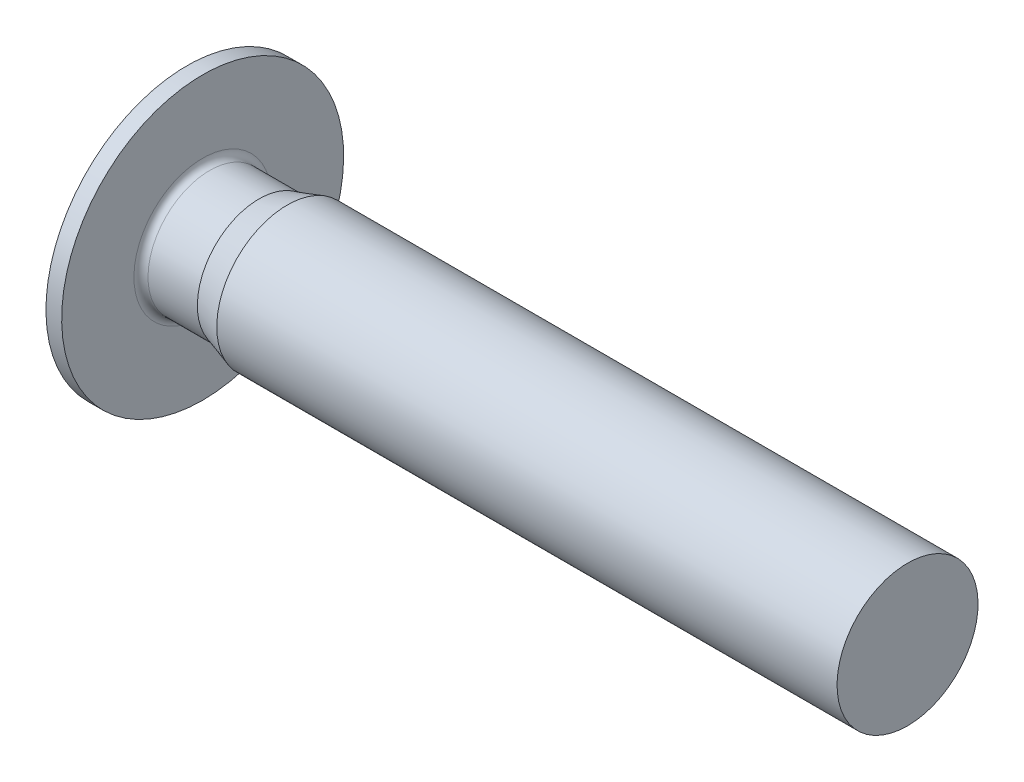
from build123d import *

# Parameters (mm, degrees)
FILLET1_R          = 0.1
CUT_EXTRUDE1_DEPTH = 1.2


with BuildPart() as part:
    # Sketch1 → Revolve1 (revolve)
    with BuildSketch(Plane.XY):
        Polygon((-0.5, 0), (-0.5, 1.52), (-0.222871871, 2), (0, 2), (0, 0.875), (0.8, 0.875), (1.2, 1), (10, 1), (10, 0), align=None)
    revolve(axis=Axis((-0.5, 0, 0), (1, 0, 0)))

    # Fillet1
    fillet1_edges = [part.edges().sort_by_distance(p)[0] for p in [
        (0, -0.875, 0),
    ]]
    fillet(fillet1_edges, radius=FILLET1_R)

    # Sketch2 → Cut-Extrude1 (cut)
    with BuildSketch(Plane.ZY.offset(0.5)):
        Polygon((0, 0.75055535), (-0.65, 0.375277675), (-0.65, -0.375277675), (0, -0.75055535), (0.65, -0.375277675), (0.65, 0.375277675), align=None)
    extrude(amount=-CUT_EXTRUDE1_DEPTH, mode=Mode.SUBTRACT)

    # Sketch3 → Cut-Revolve1 (revolve, cut)
    with BuildSketch(Plane.XY):
        Polygon((0.7, 0), (0.7, 0.65), (1.090559402, 0), align=None)
    revolve(axis=Axis((0.7, 0, 0), (1, 0, 0)), mode=Mode.SUBTRACT)


solid = part.part
